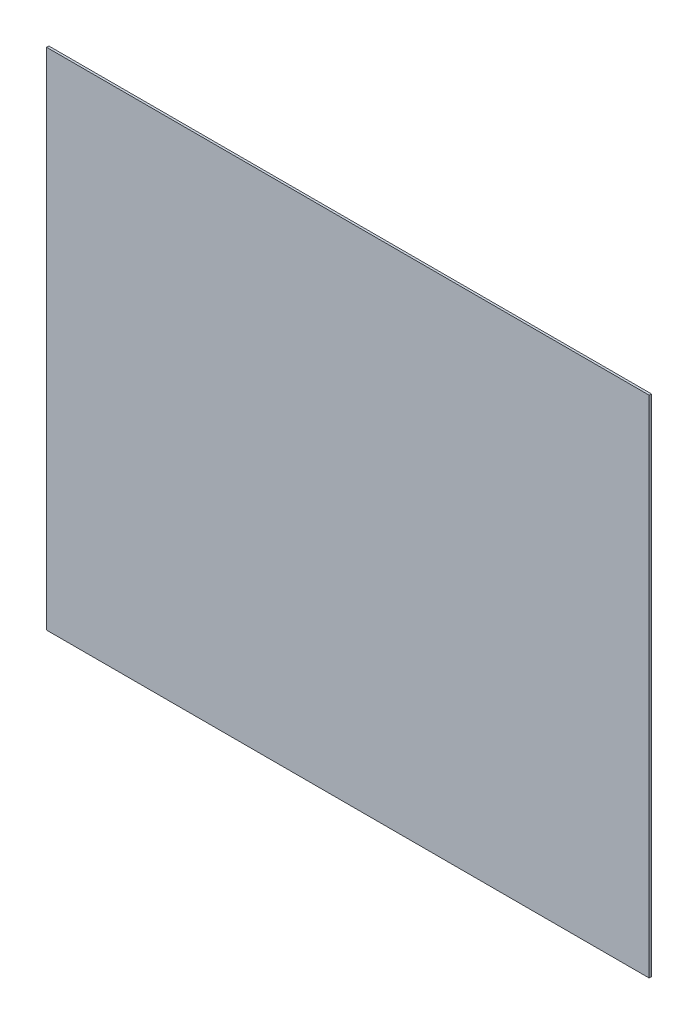
from build123d import *

# Parameters (mm, degrees)
SKETCH1_W           = 845
SKETCH1_H           = 708
BOSS_EXTRUDE1_DEPTH = 3.175


with BuildPart() as part:
    # Sketch1 → Boss-Extrude1 (new body)
    with BuildSketch(Plane.XY):
        Rectangle(SKETCH1_W, SKETCH1_H)
    extrude(amount=BOSS_EXTRUDE1_DEPTH)


solid = part.part
